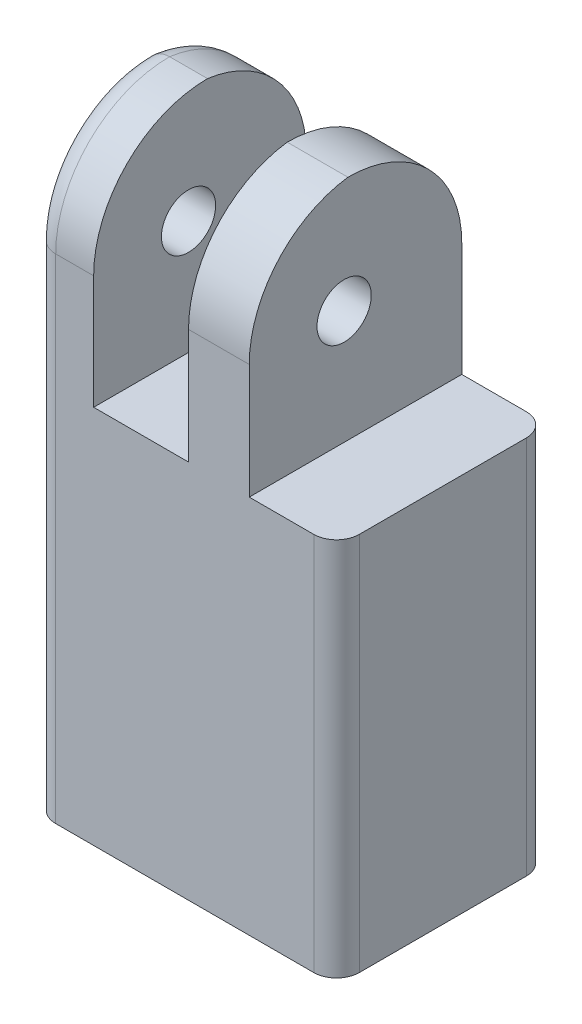
from build123d import *

# Parameters (mm, degrees)
SKETCH2_W                                 = 40
SKETCH2_H                                 = 28
BOSS_EXTRUDE2_DEPTH                       = 50
SKETCH3_W                                 = 8
SKETCH3_H                                 = 28
BOSS_EXTRUDE3_DEPTH                       = 30
F_9_32_0_28125_DIAMETER_HOLE1_D           = 7.14375
F_9_32_0_28125_DIAMETER_HOLE1_CSINK_D     = 8.41375
F_9_32_0_28125_DIAMETER_HOLE1_CSINK_ANGLE = 90
FILLET5_R                                 = 15
FILLET3_R                                 = 15
FILLET4_R                                 = 15
FILLET6_R                                 = 15
FILLET7_R                                 = 3
FILLET8_R                                 = 3


with BuildPart() as part:
    # Sketch2 → Boss-Extrude2 (new body)
    with BuildSketch(Plane(origin=(0, 0, 0), x_dir=(1, 0, 0), z_dir=(0, 1, 0))):
        with Locations((20, 14)):
            Rectangle(SKETCH2_W, SKETCH2_H)
    extrude(amount=BOSS_EXTRUDE2_DEPTH)

    # Sketch3 → Boss-Extrude3 (add)
    with BuildSketch(Plane(origin=(0, 50, 0), x_dir=(1, 0, 0), z_dir=(0, 1, 0))):
        with Locations((4, 14)):
            Rectangle(SKETCH3_W, SKETCH3_H)
        with Locations((24.5, 14)):
            Rectangle(SKETCH3_W, SKETCH3_H)
    extrude(amount=BOSS_EXTRUDE3_DEPTH)

    # 9/32 (0.28125) Diameter Hole1 (through all)
    with Locations(Plane(origin=(0, 65, -12.5), x_dir=(0, 0, -1), z_dir=(-1, 0, 0))):
        with Locations((0, 0)):
            CounterSinkHole(F_9_32_0_28125_DIAMETER_HOLE1_D / 2, F_9_32_0_28125_DIAMETER_HOLE1_CSINK_D / 2, counter_sink_angle=F_9_32_0_28125_DIAMETER_HOLE1_CSINK_ANGLE)

    # Fillet5
    fillet5_edges = [part.edges().sort_by_distance(p)[0] for p in [
        (4, 80, 0),
    ]]
    fillet(fillet5_edges, radius=FILLET5_R)

    # Fillet3
    fillet3_edges = [part.edges().sort_by_distance(p)[0] for p in [
        (24.5, 80, -28),
    ]]
    fillet(fillet3_edges, radius=FILLET3_R)

    # Fillet4
    # the kernel refuses this fillet: 15 mm, written as the material it takes off along each edge
    with BuildSketch(Plane(origin=(65.665171868, 80, 0), x_dir=(0, 0, -1), z_dir=(-1, 0, 0))) as fillet4_piece_1:
        with BuildLine():
            CenterArc((15, 14.866068747), FILLET4_R, 180, 82.337744339)
            Line((0, 14.866068747), (-0.3, 14.866068747))
            Line((-0.3, 14.866068747), (-0.3, 0))
            Line((-0.3, 0), (0, -0.3))
            ThreePointArc((0, -0.3), (6.5, -0.3), (12.96, -0.297321375))
            Line((12.96, -0.297321375), (13, 0))
        make_face()
    extrude(amount=82.330343737, mode=Mode.SUBTRACT)

    # Fillet6
    # the kernel refuses this fillet: 15 mm, written as the material it takes off along each edge
    with BuildSketch(Plane(origin=(-37.165171868, 80, -28), x_dir=(0, -1, 0), z_dir=(1, 0, 0))) as fillet6_piece_1:
        with BuildLine():
            CenterArc((14.866068747, -15), FILLET6_R, 90, 82.337744339)
            Line((0, -13), (-0.297321375, -12.96))
            ThreePointArc((-0.297321375, -12.96), (-0.3, -6.5), (-0.3, 0))
            Line((-0.3, 0), (0, 0.3))
            Line((0, 0.3), (14.866068747, 0.3))
            Line((14.866068747, 0.3), (14.866068747, 0))
        make_face()
    extrude(amount=82.330343737, mode=Mode.SUBTRACT)

    # Fillet7
    # the kernel refuses this fillet: 3 mm, written as the material it takes off along each edge
    with BuildSketch(Plane(origin=(0, 65, 0), x_dir=(1, 0, 0), z_dir=(0, -1, 0))) as fillet7_piece_1:
        with BuildLine():
            CenterArc((FILLET7_R, -FILLET7_R), FILLET7_R, 90, 90)
            Line((0, -FILLET7_R), (0, 0))
            Line((0, 0), (FILLET7_R, 0))
        make_face()
    extrude(amount=72.5, mode=Mode.SUBTRACT)
    with BuildSketch(Plane(origin=(0, 65, -15), x_dir=(0, 0, 1), z_dir=(0, -1, 0))) as fillet7_piece_2:
        with BuildLine():
            CenterArc((15 - FILLET7_R, -FILLET7_R), FILLET7_R, 0, 90)
            Line((15, -FILLET7_R), (15, 0))
            Line((15, 0), (15 - FILLET7_R, 0))
        make_face()
    revolve(axis=Axis((0, 65, -15), (-1, 0, 0)), revolution_arc=118.659397847, mode=Mode.SUBTRACT)
    with BuildSketch(Plane(origin=(0, 65.133931253, -28), x_dir=(1, 0, 0), z_dir=(0, -1, 0))) as fillet7_piece_3:
        with BuildLine():
            CenterArc((FILLET7_R, FILLET7_R), FILLET7_R, 180, 90)
            Line((0, FILLET7_R), (0, 0))
            Line((0, 0), (FILLET7_R, 0))
        make_face()
    extrude(amount=72.633931253, mode=Mode.SUBTRACT)
    with BuildSketch(Plane(origin=(0, 65.133931253, -13), x_dir=(0, 0.933610035263845, 0.3582908065449657), z_dir=(0, -0.3582908065449657, 0.933610035263845))) as fillet7_piece_4:
        with BuildLine():
            CenterArc((15 - FILLET7_R, -FILLET7_R), FILLET7_R, 360, 90)
            Line((15, -FILLET7_R), (15, 0))
            Line((15, 0), (15 - FILLET7_R, 0))
        make_face()
    revolve(axis=Axis((0, 65.133931253, -13), (-1, 0, 0)), revolution_arc=110.995265648, mode=Mode.SUBTRACT)

    # Fillet8
    fillet8_edges = [part.edges().sort_by_distance(p)[0] for p in [
        (40, 25, -28),
        (40, 25, 0),
    ]]
    fillet(fillet8_edges, radius=FILLET8_R)


solid = part.part
